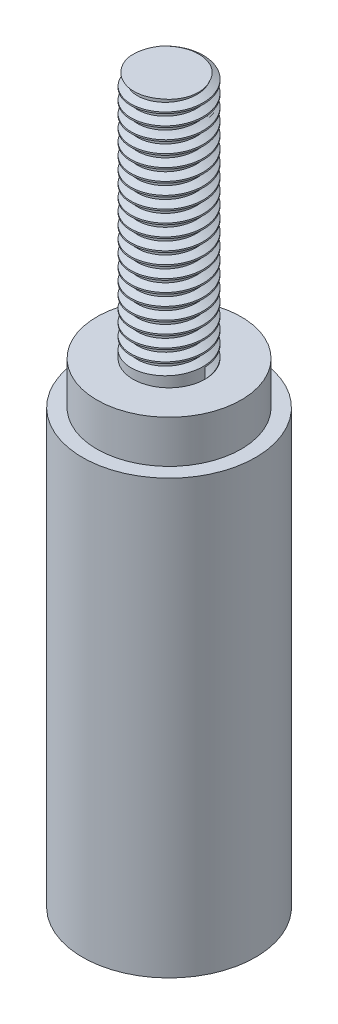
from build123d import *
from build123d.topology import SkipClean

# Parameters (mm, degrees)
SKETCH1_R           = 15.24
BOSS_EXTRUDE1_DEPTH = 76.2
SKETCH2_R           = 12.7
BOSS_EXTRUDE2_DEPTH = 7.493
SKETCH3_R           = 6.35
BOSS_EXTRUDE3_DEPTH = 43.18
THREAD1_PITCH       = 2.116666667


with BuildPart() as part:
    # Sketch1 → Boss-Extrude1 (new body)
    with BuildSketch(Plane(origin=(0, 0, 0), x_dir=(1, 0, 0), z_dir=(0, 1, 0))):
        with Locations(Location((0, 0, 0), (0, 0, 90))):
            Circle(SKETCH1_R)
    extrude(amount=BOSS_EXTRUDE1_DEPTH)

    # Sketch2 → Boss-Extrude2 (add)
    with BuildSketch(Plane(origin=(0, 76.2, 0), x_dir=(1, 0, 0), z_dir=(0, 1, 0))):
        with Locations(Location((0, 0, 0), (0, 0, 270))):
            Circle(SKETCH2_R)
    extrude(amount=BOSS_EXTRUDE2_DEPTH)

    # Sketch3 → Boss-Extrude3 (add)
    with BuildSketch(Plane(origin=(0, 83.693, 0), x_dir=(1, 0, 0), z_dir=(0, 1, 0))):
        with Locations(Location((0, 0, 0), (0, 0, 270))):
            Circle(SKETCH3_R)
    extrude(amount=BOSS_EXTRUDE3_DEPTH)

    # Thread1: the profile of Thread Profile1 profile screwed along a right-hand helix of 57.6 turns, 6 arcs to a turn; built about Z, then put on its axis
    with SkipClean():  # the faces are left unmerged after this step: merging them gives an invalid solid
        thread1_z = Axis((0, 0, 0), (0, 0, 1))
        thread1_corners = [(6.3503, 0, -0.000173205), (6.3503, 0, 1.852256533), (5.204320565, 0, 1.190624997), (5.204320565, 0, 0.66145833)]
        with BuildLine(mode=Mode.PRIVATE) as thread1_profile:
            Line(thread1_corners[0], thread1_corners[1])
            Line(thread1_corners[1], thread1_corners[2])
            Line(thread1_corners[2], thread1_corners[3])
            Line(thread1_corners[3], thread1_corners[0])
        thread1_cap = Face(thread1_profile.wire())
        thread1_turn_angles = [0, 30, 60, 90, 120, 150, 180, 210, 240, 270, 300, 330, 360, 390, 420, 450, 480, 510, 540, 570, 600, 630, 660, 690, 720]
        thread1_turn_weights = [1, 0.8660254037844387, 1, 0.8660254037844387, 1, 0.8660254037844387, 1, 0.8660254037844387, 1, 0.8660254037844387, 1, 0.8660254037844387, 1, 0.8660254037844387, 1, 0.8660254037844387, 1, 0.8660254037844387, 1, 0.8660254037844387, 1, 0.8660254037844387, 1, 0.8660254037844387, 1]
        thread1_turn_rails = [Edge.make_bspline([Vector(p[0], p[1], 0).rotate(thread1_z, thread1_turn_angles[k]) / thread1_turn_weights[k] + Vector(0, 0, p[2] + THREAD1_PITCH * thread1_turn_angles[k] / 360) for k in range(25)], [0, 0, 0, 1, 1, 2, 2, 3, 3, 4, 4, 5, 5, 6, 6, 7, 7, 8, 8, 9, 9, 10, 10, 11, 11, 12, 12, 12], 2, thread1_turn_weights) for p in thread1_corners]
        thread1_turn_sides = [Face.make_surface_from_curves(thread1_turn_rails[p[0]], thread1_turn_rails[p[1]]) for p in [(0, 1), (1, 2), (2, 3), (3, 0)]]
        thread1_last_angles = [20160, 20190, 20220, 20250, 20280, 20310, 20340, 20370, 20400, 20430, 20460, 20490, 20520, 20550, 20580, 20610, 20640, 20670, 20700, 20718, 20736]
        thread1_last_weights = [1, 0.8660254037844387, 1, 0.8660254037844387, 1, 0.8660254037844387, 1, 0.8660254037844387, 1, 0.8660254037844387, 1, 0.8660254037844387, 1, 0.8660254037844387, 1, 0.8660254037844387, 1, 0.8660254037844387, 1, 0.9510565162951438, 1]
        thread1_last_rails = [Edge.make_bspline([Vector(p[0], p[1], 0).rotate(thread1_z, thread1_last_angles[k]) / thread1_last_weights[k] + Vector(0, 0, p[2] + THREAD1_PITCH * thread1_last_angles[k] / 360) for k in range(21)], [0, 0, 0, 1, 1, 2, 2, 3, 3, 4, 4, 5, 5, 6, 6, 7, 7, 8, 8, 9, 9, 10, 10, 10], 2, thread1_last_weights) for p in thread1_corners]
        thread1_last_sides = [Face.make_surface_from_curves(thread1_last_rails[p[0]], thread1_last_rails[p[1]]) for p in [(0, 1), (1, 2), (2, 3), (3, 0)]]
        thread1 = Plane(origin=(0, 83.693, 0), x_dir=(1, 0, 0), z_dir=(0, 1, 0)) * Solid(Shell([*[p.moved(Location((0, 0, 2 * THREAD1_PITCH * i))) for i in range(28) for p in thread1_turn_sides], *thread1_last_sides, thread1_cap, thread1_cap.rotate(thread1_z, 20736).moved(Location((0, 0, THREAD1_PITCH * 20736 / 360)))]))
        add(thread1, mode=Mode.SUBTRACT)


solid = part.part
